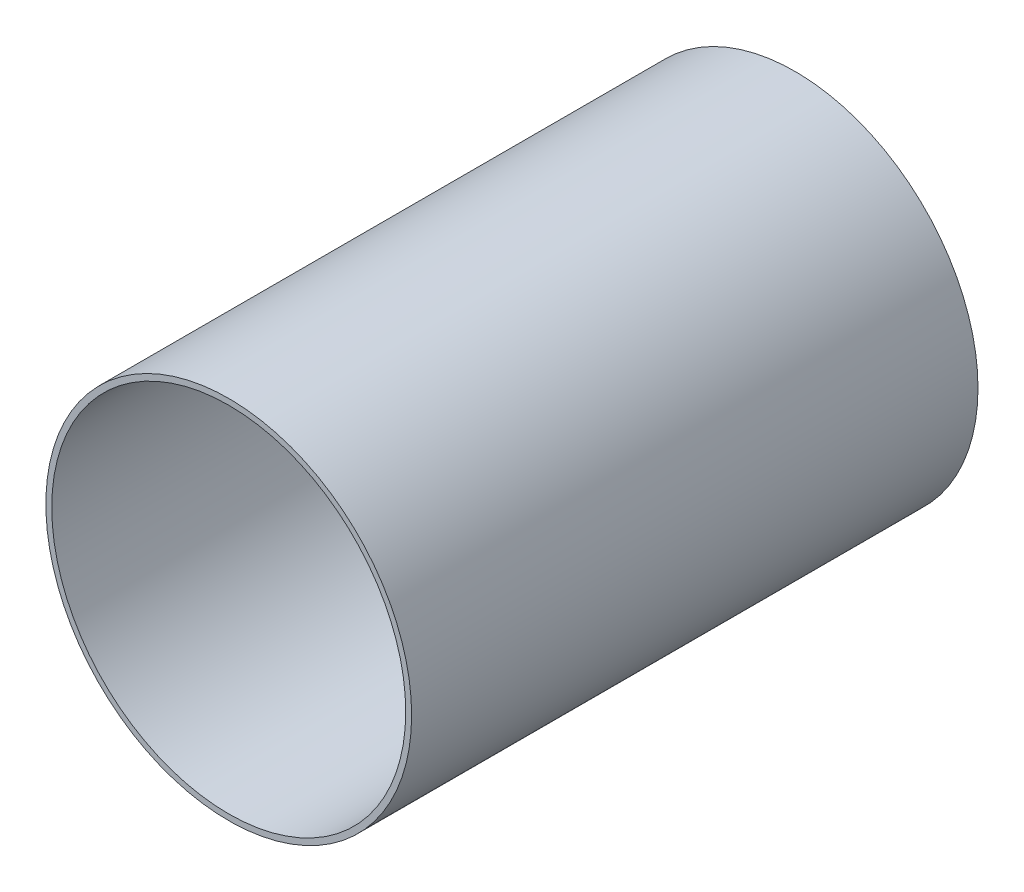
from build123d import *

# Parameters (mm, degrees)
SKETCH1_R           = 15.5
SKETCH1_R_2         = 15
BOSS_EXTRUDE1_DEPTH = 48


with BuildPart() as part:
    # Sketch1 → Boss-Extrude1 (new body)
    with BuildSketch(Plane.XY):
        Circle(SKETCH1_R)
        Circle(SKETCH1_R_2, mode=Mode.SUBTRACT)
    extrude(amount=-BOSS_EXTRUDE1_DEPTH)


solid = part.part
